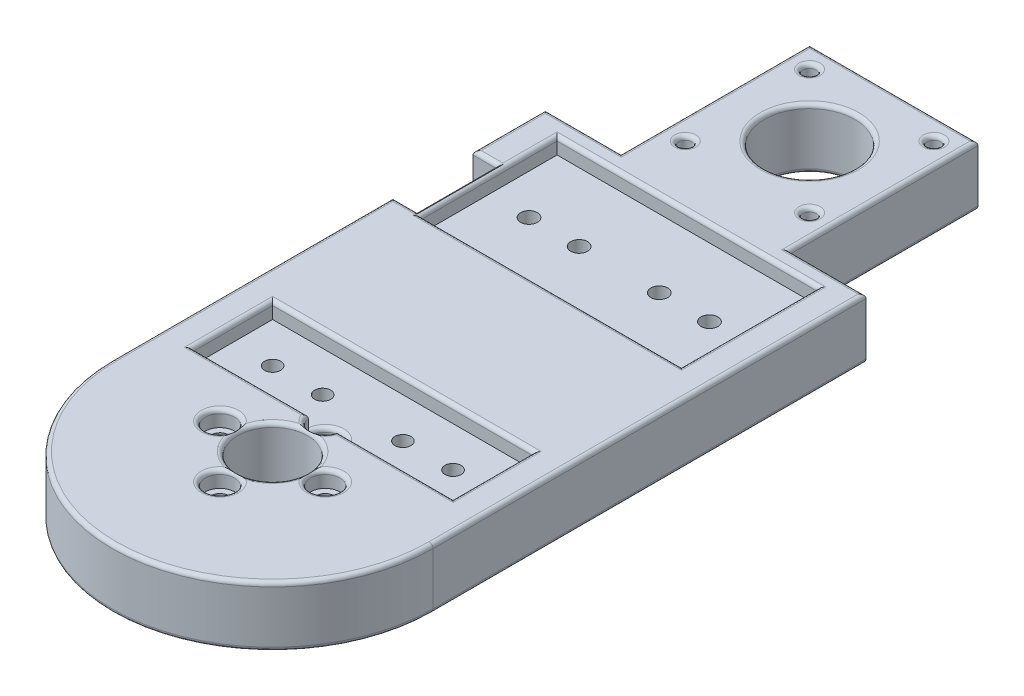
from build123d import *

# Parameters (mm, degrees)
SKIZZE1_W                        = 42
SKIZZE1_H                        = 47
SKIZZE1_R                        = 1.65
SKIZZE1_R_2                      = 11.3
SKIZZE1_R_3                      = 40
SKIZZE1_R_4                      = 17.5
SKIZZE1_R_5                      = 2.1
SKIZZE1_R_6                      = 8.75
AUFSATZ_LINEAR_AUSTRAGEN1_DEPTH  = 15
SCHNITT_LINEAR_AUSTRAGEN3_DEPTH  = 4
SKIZZE6_R                        = 2
SCHNITT_LINEAR_AUSTRAGEN4_DEPTH  = 11
SKIZZE14_W                       = 6
SKIZZE14_H                       = 20
SCHNITT_LINEAR_AUSTRAGEN11_DEPTH = 15
SKIZZE15_R                       = 2.25
SCHNITT_LINEAR_AUSTRAGEN12_DEPTH = 6
SKIZZE19_W                       = 65
SKIZZE19_H                       = 34
SCHNITT_LINEAR_AUSTRAGEN15_DEPTH = 4
SKIZZE21_R                       = 2.1
SCHNITT_LINEAR_AUSTRAGEN16_DEPTH = 11
SKIZZE22_R                       = 3.65
SCHNITT_LINEAR_AUSTRAGEN17_DEPTH = 4
SKIZZE23_R                       = 3.2
SKIZZE23_R_2                     = 11.3
SCHNITT_LINEAR_AUSTRAGEN18_DEPTH = 3
SKETCH5_R                        = 3.65
CUT_EXTRUDE3_DEPTH               = 4
SKIZZE24_R                       = 3.65
SCHNITT_LINEAR_AUSTRAGEN19_DEPTH = 4
VERRUNDUNG1_R                    = 1


with BuildPart() as part:
    # Skizze1 → Aufsatz-Linear austragen1 (new body)
    # profile 1 of 4: a face of its own
    with BuildSketch(Plane(origin=(0, 0, 0), x_dir=(1, 0, 0), z_dir=(0, 1, 0))):
        with Locations((-0.084777034, 131.5)):
            Rectangle(SKIZZE1_W, SKIZZE1_H)
        with Locations(Location((-15.584777034, 118.5, 0), (0, 0, 270))):
            Circle(SKIZZE1_R, mode=Mode.SUBTRACT)
        with Locations(Location((-15.584777034, 149.5, 0), (0, 0, 270))):
            Circle(SKIZZE1_R, mode=Mode.SUBTRACT)
        with Locations(Location((-0.084777034, 134, 0), (0, 0, 270))):
            Circle(SKIZZE1_R_2, mode=Mode.SUBTRACT)
        with Locations(Location((15.415222966, 118.5, 0), (0, 0, 270))):
            Circle(SKIZZE1_R, mode=Mode.SUBTRACT)
        with Locations(Location((15.415222966, 149.5, 0), (0, 0, 270))):
            Circle(SKIZZE1_R, mode=Mode.SUBTRACT)
    # profile 2 of 4: a face of its own
    with BuildSketch(Plane(origin=(0, 0, 0), x_dir=(1, 0, 0), z_dir=(0, 1, 0))):
        with BuildLine():
            Line((-40, 78), (-40, 0))
            ThreePointArc((-40, 0), (0, 40), (40, 0))
            Line((40, 0), (40, 108))
            Line((40, 108), (20.915222966, 108))
            Line((20.915222966, 108), (-21.084777034, 108))
            Line((-21.084777034, 108), (-40, 108))
            Line((-40, 108), (-40, 78))
        make_face()
    # profile 3 of 4: a face of its own
    with BuildSketch(Plane(origin=(0, 0, 0), x_dir=(1, 0, 0), z_dir=(0, 1, 0))):
        Circle(SKIZZE1_R_3)
        Circle(SKIZZE1_R_4, mode=Mode.SUBTRACT)
    # profile 4 of 4: a face of its own
    with BuildSketch(Plane(origin=(0, 0, 0), x_dir=(1, 0, 0), z_dir=(0, 1, 0))):
        Circle(SKIZZE1_R_4)
        with Locations(Location((-13.125, 0, 0), (0, 0, 270))):
            Circle(SKIZZE1_R_5, mode=Mode.SUBTRACT)
        with Locations(Location((0, -13.125, 0), (0, 0, 270))):
            Circle(SKIZZE1_R_5, mode=Mode.SUBTRACT)
        with Locations(Location((13.125, 0, 0), (0, 0, 270))):
            Circle(SKIZZE1_R_5, mode=Mode.SUBTRACT)
        with Locations(Location((0, 13.125, 0), (0, 0, 270))):
            Circle(SKIZZE1_R_5, mode=Mode.SUBTRACT)
        with Locations(Location((0, 0, 0), (0, 0, 270))):
            Circle(SKIZZE1_R_6, mode=Mode.SUBTRACT)
    extrude(amount=AUFSATZ_LINEAR_AUSTRAGEN1_DEPTH)

    # Skizze5 → Schnitt-Linear austragen3 (cut)
    with BuildSketch(Plane(origin=(0, 15, 0), x_dir=(1, 0, 0), z_dir=(0, 1, 0))):
        Polygon((32.5, 32.5), (-25, 32.5), (-32.5, 32.5), (-32.5, 12.5), (32.5, 12.5), align=None)
    extrude(amount=-SCHNITT_LINEAR_AUSTRAGEN3_DEPTH, mode=Mode.SUBTRACT)

    # Skizze6 → Schnitt-Linear austragen4 (cut)
    with BuildSketch(Plane(origin=(0, 11, 0), x_dir=(1, 0, 0), z_dir=(0, 1, 0))):
        with Locations(Location((10, 22.5, 0), (0, 0, 270))):
            Circle(SKIZZE6_R)
        with Locations(Location((-10, 22.5, 0), (0, 0, 90))):
            Circle(SKIZZE6_R)
        with Locations(Location((22.5, 22.5, 0), (0, 0, 270))):
            Circle(SKIZZE6_R)
        with Locations(Location((-22.5, 22.5, 0), (0, 0, 90))):
            Circle(SKIZZE6_R)
    extrude(amount=-SCHNITT_LINEAR_AUSTRAGEN4_DEPTH, mode=Mode.SUBTRACT)

    # Skizze14 → Schnitt-Linear austragen11 (cut)
    with BuildSketch(Plane(origin=(0, 15, 0), x_dir=(1, 0, 0), z_dir=(0, 1, 0))):
        with Locations((-37, 80)):
            Rectangle(SKIZZE14_W, SKIZZE14_H)
    extrude(amount=-SCHNITT_LINEAR_AUSTRAGEN11_DEPTH, mode=Mode.SUBTRACT)

    # Skizze15 → Schnitt-Linear austragen12 (cut)
    with BuildSketch(Plane.ZY.offset(34)):
        with Locations((-84.5, 7.5)):
            Circle(SKIZZE15_R)
        with Locations((-75, 7.5)):
            Circle(SKIZZE15_R)
    extrude(amount=-SCHNITT_LINEAR_AUSTRAGEN12_DEPTH, mode=Mode.SUBTRACT)

    # Skizze19 → Schnitt-Linear austragen15 (cut)
    with BuildSketch(Plane(origin=(0, 15, 0), x_dir=(1, 0, 0), z_dir=(0, 1, 0))):
        with Locations((-0.054725473, 86.5)):
            Rectangle(SKIZZE19_W, SKIZZE19_H)
    extrude(amount=-SCHNITT_LINEAR_AUSTRAGEN15_DEPTH, mode=Mode.SUBTRACT)

    # Skizze21 → Schnitt-Linear austragen16 (cut)
    with BuildSketch(Plane(origin=(0, 11, 0), x_dir=(1, 0, 0), z_dir=(0, 1, 0))):
        with Locations(Location((22.445274527, 86.5, 0), (0, 0, 270))):
            Circle(SKIZZE21_R)
        with Locations(Location((9.945274527, 86.5, 0), (0, 0, 270))):
            Circle(SKIZZE21_R)
        with Locations(Location((-22.55483254, 86.5, 0), (0, 0, 90))):
            Circle(SKIZZE21_R)
        with Locations(Location((-10.05483254, 86.5, 0), (0, 0, 90))):
            Circle(SKIZZE21_R)
    extrude(amount=-SCHNITT_LINEAR_AUSTRAGEN16_DEPTH, mode=Mode.SUBTRACT)

    # Skizze22 → Schnitt-Linear austragen17 (cut)
    with BuildSketch(Plane.XZ):
        with Locations(Location((-22.55483254, -86.5, 0), (0, 0, 270))):
            Circle(SKIZZE22_R)
        with Locations(Location((-10.05483254, -86.5, 0), (0, 0, 270))):
            Circle(SKIZZE22_R)
        with Locations(Location((10.05483254, -86.5, 0), (0, 0, 90))):
            Circle(SKIZZE22_R)
        with Locations(Location((22.55483254, -86.5, 0), (0, 0, 90))):
            Circle(SKIZZE22_R)
        with Locations(Location((-22.5, -22.5, 0), (0, 0, 270))):
            Circle(SKIZZE22_R)
        with Locations(Location((-10, -22.5, 0), (0, 0, 270))):
            Circle(SKIZZE22_R)
        with Locations(Location((10, -22.5, 0), (0, 0, 90))):
            Circle(SKIZZE22_R)
        with Locations(Location((22.5, -22.5, 0), (0, 0, 90))):
            Circle(SKIZZE22_R)
    extrude(amount=-SCHNITT_LINEAR_AUSTRAGEN17_DEPTH, mode=Mode.SUBTRACT)

    # Skizze23 → Schnitt-Linear austragen18 (cut)
    with BuildSketch(Plane.XZ):
        with Locations(Location((-15.584777034, -118.5, 0), (0, 0, 270))):
            Circle(SKIZZE23_R)
        with Locations(Location((-0.084777034, -134, 0), (0, 0, 90))):
            Circle(SKIZZE23_R_2)
        with Locations(Location((15.415222966, -118.5, 0), (0, 0, 270))):
            Circle(SKIZZE23_R)
        with Locations(Location((15.415222966, -149.5, 0), (0, 0, 270))):
            Circle(SKIZZE23_R)
        with Locations(Location((-15.584777034, -149.5, 0), (0, 0, 270))):
            Circle(SKIZZE23_R)
    extrude(amount=-SCHNITT_LINEAR_AUSTRAGEN18_DEPTH, mode=Mode.SUBTRACT)

    # Sketch5 → Cut-Extrude3 (cut)
    with BuildSketch(Plane(origin=(0, 15, 0), x_dir=(1, 0, 0), z_dir=(0, 1, 0))):
        with Locations(Location((-13.125, 0, 0), (0, 0, 270))):
            Circle(SKETCH5_R)
        with Locations((0, 13.125)):
            Circle(SKETCH5_R)
        with Locations(Location((13.125, 0, 0), (0, 0, 270))):
            Circle(SKETCH5_R)
        with Locations(Location((0, -13.125, 0), (0, 0, 270))):
            Circle(SKETCH5_R)
    extrude(amount=-CUT_EXTRUDE3_DEPTH, mode=Mode.SUBTRACT)

    # Skizze24 → Schnitt-Linear austragen19 (cut)
    with BuildSketch(Plane(origin=(0, 11, 0), x_dir=(1, 0, 0), z_dir=(0, 1, 0))):
        with Locations(Location((0, 13.125, 0), (0, 0, 270))):
            Circle(SKIZZE24_R)
    extrude(amount=-SCHNITT_LINEAR_AUSTRAGEN19_DEPTH, mode=Mode.SUBTRACT)

    # Verrundung1
    # the kernel refuses this fillet: 1 mm, written as the material it takes off along each edge
    with BuildSketch(Plane(origin=(0, 15, 0), x_dir=(0, 0, 1), z_dir=(-1, 0, 0))) as verrundung1_piece_1:
        with BuildLine():
            CenterArc((8.75 + VERRUNDUNG1_R, -VERRUNDUNG1_R), VERRUNDUNG1_R, 90, 90)
            Line((8.75, -VERRUNDUNG1_R), (8.75, 0))
            Line((8.75, 0), (8.75 + VERRUNDUNG1_R, 0))
        make_face()
    revolve(axis=Axis((0, 15, 0), (0, 1, 0)), mode=Mode.SUBTRACT)
    with BuildSketch(Plane(origin=(-40, 0, -110.5), x_dir=(1, 0, 0), z_dir=(0, 0, 1)), Plane(origin=(-40, 15, -87.5), x_dir=(1, 0, 0), z_dir=(0, 0, -1))) as verrundung1_piece_2:
        with BuildLine():
            CenterArc((VERRUNDUNG1_R, VERRUNDUNG1_R), VERRUNDUNG1_R, 180, 90)
            Line((0, VERRUNDUNG1_R), (0, 0))
            Line((0, 0), (VERRUNDUNG1_R, 0))
        make_face()
    extrude(amount=23, mode=Mode.SUBTRACT)
    with BuildSketch(Plane(origin=(-34, 0, -70), x_dir=(0, 0, 1), z_dir=(-1, 0, 0)), Plane(origin=(-42.5, 0, -90), x_dir=(0, 0, -1), z_dir=(1, 0, 0))) as verrundung1_piece_3:
        with BuildLine():
            CenterArc((VERRUNDUNG1_R, VERRUNDUNG1_R), VERRUNDUNG1_R, 180, 90)
            Line((0, VERRUNDUNG1_R), (0, 0))
            Line((0, 0), (VERRUNDUNG1_R, 0))
        make_face()
    extrude(amount=8.5, mode=Mode.SUBTRACT)
    with BuildSketch(Plane(origin=(-42.5, 15, -90), x_dir=(0, 0, -1), z_dir=(1, 0, 0)), Plane(origin=(-34, 15, -70), x_dir=(0, 0, 1), z_dir=(-1, 0, 0))) as verrundung1_piece_4:
        with BuildLine():
            CenterArc((VERRUNDUNG1_R, -VERRUNDUNG1_R), VERRUNDUNG1_R, 90, 90)
            Line((0, -VERRUNDUNG1_R), (0, 0))
            Line((0, 0), (VERRUNDUNG1_R, 0))
        make_face()
    extrude(amount=8.5, mode=Mode.SUBTRACT)
    with BuildSketch(Plane(origin=(-34, 15, -90), x_dir=(1, 0, 0), z_dir=(0, 0, 1))) as verrundung1_piece_5:
        with BuildLine():
            CenterArc((VERRUNDUNG1_R, -VERRUNDUNG1_R), VERRUNDUNG1_R, 90, 90)
            Line((0, -VERRUNDUNG1_R), (0, 0))
            Line((0, 0), (VERRUNDUNG1_R, 0))
        make_face()
    extrude(amount=20, mode=Mode.SUBTRACT)
    with BuildSketch(Plane(origin=(-34, 0, -90), x_dir=(1, 0, 0), z_dir=(0, 0, 1)), Plane(origin=(-32.5, 15, -32.5), x_dir=(-1, 0, 0), z_dir=(0, 0, 1)), Plane(origin=(32.5, 15, -12.5), x_dir=(1, 0, 0), z_dir=(0, 0, -1))) as verrundung1_piece_6:
        with BuildLine():
            CenterArc((VERRUNDUNG1_R, VERRUNDUNG1_R), VERRUNDUNG1_R, 180, 90)
            Line((0, VERRUNDUNG1_R), (0, 0))
            Line((0, 0), (VERRUNDUNG1_R, 0))
        make_face()
    extrude(amount=20, mode=Mode.SUBTRACT)
    with BuildSketch(Plane(origin=(32.445274527, 15, -69.5), x_dir=(1, 0, 0), z_dir=(0, 0, -1)), Plane(origin=(-32.554725473, 15, -103.5), x_dir=(-1, 0, 0), z_dir=(0, 0, 1))) as verrundung1_piece_7:
        with BuildLine():
            CenterArc((VERRUNDUNG1_R, VERRUNDUNG1_R), VERRUNDUNG1_R, 180, 90)
            Line((0, VERRUNDUNG1_R), (0, 0))
            Line((0, 0), (VERRUNDUNG1_R, 0))
        make_face()
    extrude(amount=34, mode=Mode.SUBTRACT)
    with BuildSketch(Plane(origin=(32.445274527, 15, -103.5), x_dir=(0, 0, -1), z_dir=(-1, 0, 0)), Plane(origin=(-32.554725473, 15, -69.5), x_dir=(0, 0, 1), z_dir=(1, 0, 0))) as verrundung1_piece_8:
        with BuildLine():
            CenterArc((VERRUNDUNG1_R, VERRUNDUNG1_R), VERRUNDUNG1_R, 180, 90)
            Line((0, VERRUNDUNG1_R), (0, 0))
            Line((0, 0), (VERRUNDUNG1_R, 0))
        make_face()
    extrude(amount=65, mode=Mode.SUBTRACT)
    with BuildSketch(Plane(origin=(-15.584777034, 15, -118.5), x_dir=(0, 0, 1), z_dir=(-1, 0, 0))) as verrundung1_piece_9:
        with BuildLine():
            CenterArc((1.65 + VERRUNDUNG1_R, -VERRUNDUNG1_R), VERRUNDUNG1_R, 90, 90)
            Line((1.65, -VERRUNDUNG1_R), (1.65, 0))
            Line((1.65, 0), (1.65 + VERRUNDUNG1_R, 0))
        make_face()
    revolve(axis=Axis((-15.584777034, 15, -118.5), (0, 1, 0)), mode=Mode.SUBTRACT)
    with BuildSketch(Plane(origin=(-22.5, 0, -22.5), x_dir=(0, 0, -1), z_dir=(-1, 0, 0))) as verrundung1_piece_10:
        with BuildLine():
            CenterArc((3.65 + VERRUNDUNG1_R, -VERRUNDUNG1_R), VERRUNDUNG1_R, 90, 90)
            Line((3.65, -VERRUNDUNG1_R), (3.65, 0))
            Line((3.65, 0), (3.65 + VERRUNDUNG1_R, 0))
        make_face()
    revolve(axis=Axis((-22.5, 0, -22.5), (0, -1, 0)), mode=Mode.SUBTRACT)
    with BuildSketch(Plane(origin=(22.55483254, 0, -86.5), x_dir=(0, 0, 1), z_dir=(1, 0, 0))) as verrundung1_piece_11:
        with BuildLine():
            CenterArc((3.65 + VERRUNDUNG1_R, -VERRUNDUNG1_R), VERRUNDUNG1_R, 90, 90)
            Line((3.65, -VERRUNDUNG1_R), (3.65, 0))
            Line((3.65, 0), (3.65 + VERRUNDUNG1_R, 0))
        make_face()
    revolve(axis=Axis((22.55483254, 0, -86.5), (0, -1, 0)), mode=Mode.SUBTRACT)
    with BuildSketch(Plane(origin=(10.05483254, 0, -86.5), x_dir=(0, 0, 1), z_dir=(1, 0, 0))) as verrundung1_piece_12:
        with BuildLine():
            CenterArc((3.65 + VERRUNDUNG1_R, -VERRUNDUNG1_R), VERRUNDUNG1_R, 90, 90)
            Line((3.65, -VERRUNDUNG1_R), (3.65, 0))
            Line((3.65, 0), (3.65 + VERRUNDUNG1_R, 0))
        make_face()
    revolve(axis=Axis((10.05483254, 0, -86.5), (0, -1, 0)), mode=Mode.SUBTRACT)
    with BuildSketch(Plane(origin=(15.415222966, 15, -118.5), x_dir=(0, 0, 1), z_dir=(-1, 0, 0))) as verrundung1_piece_13:
        with BuildLine():
            CenterArc((1.65 + VERRUNDUNG1_R, -VERRUNDUNG1_R), VERRUNDUNG1_R, 90, 90)
            Line((1.65, -VERRUNDUNG1_R), (1.65, 0))
            Line((1.65, 0), (1.65 + VERRUNDUNG1_R, 0))
        make_face()
    revolve(axis=Axis((15.415222966, 15, -118.5), (0, 1, 0)), mode=Mode.SUBTRACT)
    with BuildSketch(Plane(origin=(-10.05483254, 0, -86.5), x_dir=(0, 0, -1), z_dir=(-1, 0, 0))) as verrundung1_piece_14:
        with BuildLine():
            CenterArc((3.65 + VERRUNDUNG1_R, -VERRUNDUNG1_R), VERRUNDUNG1_R, 90, 90)
            Line((3.65, -VERRUNDUNG1_R), (3.65, 0))
            Line((3.65, 0), (3.65 + VERRUNDUNG1_R, 0))
        make_face()
    revolve(axis=Axis((-10.05483254, 0, -86.5), (0, -1, 0)), mode=Mode.SUBTRACT)
    with BuildSketch(Plane(origin=(-10, 0, -22.5), x_dir=(0, 0, -1), z_dir=(-1, 0, 0))) as verrundung1_piece_15:
        with BuildLine():
            CenterArc((3.65 + VERRUNDUNG1_R, -VERRUNDUNG1_R), VERRUNDUNG1_R, 90, 90)
            Line((3.65, -VERRUNDUNG1_R), (3.65, 0))
            Line((3.65, 0), (3.65 + VERRUNDUNG1_R, 0))
        make_face()
    revolve(axis=Axis((-10, 0, -22.5), (0, -1, 0)), mode=Mode.SUBTRACT)
    with BuildSketch(Plane(origin=(10, 0, -22.5), x_dir=(0, 0, 1), z_dir=(1, 0, 0))) as verrundung1_piece_16:
        with BuildLine():
            CenterArc((3.65 + VERRUNDUNG1_R, -VERRUNDUNG1_R), VERRUNDUNG1_R, 90, 90)
            Line((3.65, -VERRUNDUNG1_R), (3.65, 0))
            Line((3.65, 0), (3.65 + VERRUNDUNG1_R, 0))
        make_face()
    revolve(axis=Axis((10, 0, -22.5), (0, -1, 0)), mode=Mode.SUBTRACT)
    with BuildSketch(Plane(origin=(22.5, 0, -22.5), x_dir=(0, 0, 1), z_dir=(1, 0, 0))) as verrundung1_piece_17:
        with BuildLine():
            CenterArc((3.65 + VERRUNDUNG1_R, -VERRUNDUNG1_R), VERRUNDUNG1_R, 90, 90)
            Line((3.65, -VERRUNDUNG1_R), (3.65, 0))
            Line((3.65, 0), (3.65 + VERRUNDUNG1_R, 0))
        make_face()
    revolve(axis=Axis((22.5, 0, -22.5), (0, -1, 0)), mode=Mode.SUBTRACT)
    with BuildSketch(Plane(origin=(-22.55483254, 0, -86.5), x_dir=(0, 0, -1), z_dir=(-1, 0, 0))) as verrundung1_piece_18:
        with BuildLine():
            CenterArc((3.65 + VERRUNDUNG1_R, -VERRUNDUNG1_R), VERRUNDUNG1_R, 90, 90)
            Line((3.65, -VERRUNDUNG1_R), (3.65, 0))
            Line((3.65, 0), (3.65 + VERRUNDUNG1_R, 0))
        make_face()
    revolve(axis=Axis((-22.55483254, 0, -86.5), (0, -1, 0)), mode=Mode.SUBTRACT)
    with BuildSketch(Plane(origin=(0, 0, 0), x_dir=(0, 0, 1), z_dir=(-1, 0, 0))) as verrundung1_piece_19:
        with BuildLine():
            CenterArc((8.75 + VERRUNDUNG1_R, VERRUNDUNG1_R), VERRUNDUNG1_R, 180, 90)
            Line((8.75, VERRUNDUNG1_R), (8.75, 0))
            Line((8.75, 0), (8.75 + VERRUNDUNG1_R, 0))
        make_face()
    revolve(axis=Axis((0, 0, 0), (0, 1, 0)), mode=Mode.SUBTRACT)
    with BuildSketch(Plane(origin=(0, 0, -13.125), x_dir=(0, 0, 1), z_dir=(-1, 0, 0))) as verrundung1_piece_20:
        with BuildLine():
            CenterArc((2.1 + VERRUNDUNG1_R, VERRUNDUNG1_R), VERRUNDUNG1_R, 180, 90)
            Line((2.1, VERRUNDUNG1_R), (2.1, 0))
            Line((2.1, 0), (2.1 + VERRUNDUNG1_R, 0))
        make_face()
    revolve(axis=Axis((0, 0, -13.125), (0, 1, 0)), mode=Mode.SUBTRACT)
    with BuildSketch(Plane(origin=(13.125, 0, 0), x_dir=(0, 0, 1), z_dir=(-1, 0, 0))) as verrundung1_piece_21:
        with BuildLine():
            CenterArc((2.1 + VERRUNDUNG1_R, VERRUNDUNG1_R), VERRUNDUNG1_R, 180, 90)
            Line((2.1, VERRUNDUNG1_R), (2.1, 0))
            Line((2.1, 0), (2.1 + VERRUNDUNG1_R, 0))
        make_face()
    revolve(axis=Axis((13.125, 0, 0), (0, 1, 0)), mode=Mode.SUBTRACT)
    with BuildSketch(Plane(origin=(0, 0, 13.125), x_dir=(0, 0, 1), z_dir=(-1, 0, 0))) as verrundung1_piece_22:
        with BuildLine():
            CenterArc((2.1 + VERRUNDUNG1_R, VERRUNDUNG1_R), VERRUNDUNG1_R, 180, 90)
            Line((2.1, VERRUNDUNG1_R), (2.1, 0))
            Line((2.1, 0), (2.1 + VERRUNDUNG1_R, 0))
        make_face()
    revolve(axis=Axis((0, 0, 13.125), (0, 1, 0)), mode=Mode.SUBTRACT)
    with BuildSketch(Plane(origin=(-13.125, 0, 0), x_dir=(0, 0, 1), z_dir=(-1, 0, 0))) as verrundung1_piece_23:
        with BuildLine():
            CenterArc((2.1 + VERRUNDUNG1_R, VERRUNDUNG1_R), VERRUNDUNG1_R, 180, 90)
            Line((2.1, VERRUNDUNG1_R), (2.1, 0))
            Line((2.1, 0), (2.1 + VERRUNDUNG1_R, 0))
        make_face()
    revolve(axis=Axis((-13.125, 0, 0), (0, 1, 0)), mode=Mode.SUBTRACT)
    with BuildSketch(Plane(origin=(23.415222966, 0, -155), x_dir=(0, 0, 1), z_dir=(-1, 0, 0))) as verrundung1_piece_24:
        with BuildLine():
            CenterArc((VERRUNDUNG1_R, VERRUNDUNG1_R), VERRUNDUNG1_R, 180, 90)
            Line((0, VERRUNDUNG1_R), (0, 0))
            Line((0, 0), (VERRUNDUNG1_R, 0))
        make_face()
    extrude(amount=47, mode=Mode.SUBTRACT)
    with BuildSketch(Plane(origin=(-15.584777034, 0, -149.5), x_dir=(0, 0, -1), z_dir=(-1, 0, 0))) as verrundung1_piece_25:
        with BuildLine():
            CenterArc((3.2 + VERRUNDUNG1_R, -VERRUNDUNG1_R), VERRUNDUNG1_R, 90, 90)
            Line((3.2, -VERRUNDUNG1_R), (3.2, 0))
            Line((3.2, 0), (3.2 + VERRUNDUNG1_R, 0))
        make_face()
    revolve(axis=Axis((-15.584777034, 0, -149.5), (0, -1, 0)), mode=Mode.SUBTRACT)
    with BuildSketch(Plane(origin=(15.415222966, 0, -149.5), x_dir=(0, 0, -1), z_dir=(-1, 0, 0))) as verrundung1_piece_26:
        with BuildLine():
            CenterArc((3.2 + VERRUNDUNG1_R, -VERRUNDUNG1_R), VERRUNDUNG1_R, 90, 90)
            Line((3.2, -VERRUNDUNG1_R), (3.2, 0))
            Line((3.2, 0), (3.2 + VERRUNDUNG1_R, 0))
        make_face()
    revolve(axis=Axis((15.415222966, 0, -149.5), (0, -1, 0)), mode=Mode.SUBTRACT)
    with BuildSketch(Plane(origin=(20.915222966, 0, -108), x_dir=(-1, 0, 0), z_dir=(0, 0, -1)), Plane(origin=(-21.084777034, 0, -157.5), x_dir=(1, 0, 0), z_dir=(0, 0, 1))) as verrundung1_piece_27:
        with BuildLine():
            CenterArc((VERRUNDUNG1_R, VERRUNDUNG1_R), VERRUNDUNG1_R, 180, 90)
            Line((0, VERRUNDUNG1_R), (0, 0))
            Line((0, 0), (VERRUNDUNG1_R, 0))
        make_face()
    extrude(amount=49.5, mode=Mode.SUBTRACT)
    with BuildSketch(Plane(origin=(15.415222966, 0, -118.5), x_dir=(0, 0, -1), z_dir=(-1, 0, 0))) as verrundung1_piece_28:
        with BuildLine():
            CenterArc((3.2 + VERRUNDUNG1_R, -VERRUNDUNG1_R), VERRUNDUNG1_R, 90, 90)
            Line((3.2, -VERRUNDUNG1_R), (3.2, 0))
            Line((3.2, 0), (3.2 + VERRUNDUNG1_R, 0))
        make_face()
    revolve(axis=Axis((15.415222966, 0, -118.5), (0, -1, 0)), mode=Mode.SUBTRACT)
    with BuildSketch(Plane(origin=(15.415222966, 15, -149.5), x_dir=(0, 0, 1), z_dir=(-1, 0, 0))) as verrundung1_piece_29:
        with BuildLine():
            CenterArc((1.65 + VERRUNDUNG1_R, -VERRUNDUNG1_R), VERRUNDUNG1_R, 90, 90)
            Line((1.65, -VERRUNDUNG1_R), (1.65, 0))
            Line((1.65, 0), (1.65 + VERRUNDUNG1_R, 0))
        make_face()
    revolve(axis=Axis((15.415222966, 15, -149.5), (0, 1, 0)), mode=Mode.SUBTRACT)
    with BuildSketch(Plane(origin=(42.5, 0, -108), x_dir=(0, 1, 0), z_dir=(-1, 0, 0)), Plane(origin=(20.915222966, 15, -108), x_dir=(0, -1, 0), z_dir=(1, 0, 0))) as verrundung1_piece_30:
        with BuildLine():
            CenterArc((VERRUNDUNG1_R, -VERRUNDUNG1_R), VERRUNDUNG1_R, 90, 90)
            Line((0, -VERRUNDUNG1_R), (0, 0))
            Line((0, 0), (VERRUNDUNG1_R, 0))
        make_face()
    extrude(amount=21.584777034, mode=Mode.SUBTRACT)
    with BuildSketch(Plane(origin=(-15.584777034, 0, -118.5), x_dir=(0, 0, -1), z_dir=(-1, 0, 0))) as verrundung1_piece_31:
        with BuildLine():
            CenterArc((3.2 + VERRUNDUNG1_R, -VERRUNDUNG1_R), VERRUNDUNG1_R, 90, 90)
            Line((3.2, -VERRUNDUNG1_R), (3.2, 0))
            Line((3.2, 0), (3.2 + VERRUNDUNG1_R, 0))
        make_face()
    revolve(axis=Axis((-15.584777034, 0, -118.5), (0, -1, 0)), mode=Mode.SUBTRACT)
    with BuildSketch(Plane(origin=(40, 0, 0), x_dir=(0, 1, 0), z_dir=(0, 0, -1))) as verrundung1_piece_32:
        with BuildLine():
            CenterArc((VERRUNDUNG1_R, -VERRUNDUNG1_R), VERRUNDUNG1_R, 90, 90)
            Line((0, -VERRUNDUNG1_R), (0, 0))
            Line((0, 0), (VERRUNDUNG1_R, 0))
        make_face()
    extrude(amount=110.5, mode=Mode.SUBTRACT)
    with BuildSketch(Plane(origin=(0, 0, 0), x_dir=(-1, 0, 0), z_dir=(0, 0, -1))) as verrundung1_piece_33:
        with BuildLine():
            CenterArc((40 - VERRUNDUNG1_R, VERRUNDUNG1_R), VERRUNDUNG1_R, 270, 90)
            Line((40 - VERRUNDUNG1_R, 0), (40, 0))
            Line((40, 0), (40, VERRUNDUNG1_R))
        make_face()
    revolve(axis=Axis((0, 0, 0), (0, 1, 0)), revolution_arc=180, mode=Mode.SUBTRACT)
    with BuildSketch(Plane(origin=(-40, 0, -72.5), x_dir=(1, 0, 0), z_dir=(0, 0, 1)), Plane(origin=(-40, 15, 0), x_dir=(1, 0, 0), z_dir=(0, 0, -1))) as verrundung1_piece_34:
        with BuildLine():
            CenterArc((VERRUNDUNG1_R, VERRUNDUNG1_R), VERRUNDUNG1_R, 180, 90)
            Line((0, VERRUNDUNG1_R), (0, 0))
            Line((0, 0), (VERRUNDUNG1_R, 0))
        make_face()
    extrude(amount=72.5, mode=Mode.SUBTRACT)
    with BuildSketch(Plane(origin=(1.096091628, 15, -12.5), x_dir=(0, 0, 1), z_dir=(1, 0, 0)), Plane(origin=(-32.5, 15, -12.5), x_dir=(0, 0, 1), z_dir=(1, 0, 0))) as verrundung1_piece_35:
        with BuildLine():
            CenterArc((VERRUNDUNG1_R, VERRUNDUNG1_R), VERRUNDUNG1_R, 180, 90)
            Line((0, VERRUNDUNG1_R), (0, 0))
            Line((0, 0), (VERRUNDUNG1_R, 0))
        make_face()
    extrude(amount=31.403908372, mode=Mode.SUBTRACT)
    with BuildSketch(Plane(origin=(-21.084777034, 0, -108), x_dir=(0, 0, 1), z_dir=(-1, 0, 0)), Plane(origin=(-42.5, 15, -108), x_dir=(0, 0, 1), z_dir=(1, 0, 0))) as verrundung1_piece_36:
        with BuildLine():
            CenterArc((VERRUNDUNG1_R, VERRUNDUNG1_R), VERRUNDUNG1_R, 180, 90)
            Line((0, VERRUNDUNG1_R), (0, 0))
            Line((0, 0), (VERRUNDUNG1_R, 0))
        make_face()
    extrude(amount=21.415222966, mode=Mode.SUBTRACT)
    with BuildSketch(Plane(origin=(-13.125, 15, 0), x_dir=(0, 0, 1), z_dir=(-1, 0, 0))) as verrundung1_piece_37:
        with BuildLine():
            CenterArc((3.65 + VERRUNDUNG1_R, -VERRUNDUNG1_R), VERRUNDUNG1_R, 90, 90)
            Line((3.65, -VERRUNDUNG1_R), (3.65, 0))
            Line((3.65, 0), (3.65 + VERRUNDUNG1_R, 0))
        make_face()
    revolve(axis=Axis((-13.125, 15, 0), (0, 1, 0)), mode=Mode.SUBTRACT)
    with BuildSketch(Plane(origin=(0, 15, -13.125), x_dir=(-0.8709205906379706, 0, -0.4914237731355783), z_dir=(0.4914237731355783, 0, -0.8709205906379706))) as verrundung1_piece_38:
        with BuildLine():
            CenterArc((3.65 + VERRUNDUNG1_R, -VERRUNDUNG1_R), VERRUNDUNG1_R, 90, 90)
            Line((3.65, -VERRUNDUNG1_R), (3.65, 0))
            Line((3.65, 0), (3.65 + VERRUNDUNG1_R, 0))
        make_face()
    revolve(axis=Axis((0, 15, -13.125), (0, 1, 0)), revolution_arc=238.868410159, mode=Mode.SUBTRACT)
    with BuildSketch(Plane(origin=(-0.084777034, 0, -134), x_dir=(0, 0, 1), z_dir=(-1, 0, 0))) as verrundung1_piece_39:
        with BuildLine():
            CenterArc((11.3 + VERRUNDUNG1_R, VERRUNDUNG1_R), VERRUNDUNG1_R, 180, 90)
            Line((11.3, VERRUNDUNG1_R), (11.3, 0))
            Line((11.3, 0), (11.3 + VERRUNDUNG1_R, 0))
        make_face()
    revolve(axis=Axis((-0.084777034, 0, -134), (0, 1, 0)), mode=Mode.SUBTRACT)
    with BuildSketch(Plane(origin=(13.125, 15, 0), x_dir=(0, 0, 1), z_dir=(-1, 0, 0))) as verrundung1_piece_40:
        with BuildLine():
            CenterArc((3.65 + VERRUNDUNG1_R, -VERRUNDUNG1_R), VERRUNDUNG1_R, 90, 90)
            Line((3.65, -VERRUNDUNG1_R), (3.65, 0))
            Line((3.65, 0), (3.65 + VERRUNDUNG1_R, 0))
        make_face()
    revolve(axis=Axis((13.125, 15, 0), (0, 1, 0)), mode=Mode.SUBTRACT)
    with BuildSketch(Plane(origin=(0, 15, 13.125), x_dir=(0, 0, 1), z_dir=(-1, 0, 0))) as verrundung1_piece_41:
        with BuildLine():
            CenterArc((3.65 + VERRUNDUNG1_R, -VERRUNDUNG1_R), VERRUNDUNG1_R, 90, 90)
            Line((3.65, -VERRUNDUNG1_R), (3.65, 0))
            Line((3.65, 0), (3.65 + VERRUNDUNG1_R, 0))
        make_face()
    revolve(axis=Axis((0, 15, 13.125), (0, 1, 0)), mode=Mode.SUBTRACT)
    with BuildSketch(Plane(origin=(-15.584777034, 15, -149.5), x_dir=(0, 0, 1), z_dir=(-1, 0, 0))) as verrundung1_piece_42:
        with BuildLine():
            CenterArc((1.65 + VERRUNDUNG1_R, -VERRUNDUNG1_R), VERRUNDUNG1_R, 90, 90)
            Line((1.65, -VERRUNDUNG1_R), (1.65, 0))
            Line((1.65, 0), (1.65 + VERRUNDUNG1_R, 0))
        make_face()
    revolve(axis=Axis((-15.584777034, 15, -149.5), (0, 1, 0)), mode=Mode.SUBTRACT)
    with BuildSketch(Plane(origin=(0, 11, -13.125), x_dir=(0.6536727855523831, 0, 0.7567773050430279), z_dir=(-0.7567773050430279, 0, 0.6536727855523831))) as verrundung1_piece_43_section:
        with BuildLine():
            CenterArc((3.65 + VERRUNDUNG1_R, -VERRUNDUNG1_R), VERRUNDUNG1_R, 90, 90)
            Line((3.65 + VERRUNDUNG1_R, 0), (3.65, 0))
            Line((3.65, 0), (3.65, -VERRUNDUNG1_R))
        make_face()
    verrundung1_piece_43 = revolve(axis=Axis((0, 11, -13.125), (0, 1, 0)), revolution_arc=278.361820048, mode=Mode.PRIVATE)
    verrundung1_piece_43 = split(verrundung1_piece_43, bisect_by=Plane(origin=(0, 11, -12.5), z_dir=(0, 0, -1)), keep=Keep.TOP, mode=Mode.PRIVATE)
    add(verrundung1_piece_43, mode=Mode.SUBTRACT)
    with BuildSketch(Plane(origin=(-0.084777034, 15, -134), x_dir=(0, 0, 1), z_dir=(-1, 0, 0))) as verrundung1_piece_44:
        with BuildLine():
            CenterArc((11.3 + VERRUNDUNG1_R, -VERRUNDUNG1_R), VERRUNDUNG1_R, 90, 90)
            Line((11.3, -VERRUNDUNG1_R), (11.3, 0))
            Line((11.3, 0), (11.3 + VERRUNDUNG1_R, 0))
        make_face()
    revolve(axis=Axis((-0.084777034, 15, -134), (0, 1, 0)), mode=Mode.SUBTRACT)
    with BuildSketch(Plane(origin=(-21.084777034, 15, -157.5), x_dir=(1, 0, 0), z_dir=(0, 0, 1)), Plane(origin=(20.915222966, 15, -108), x_dir=(-1, 0, 0), z_dir=(0, 0, -1))) as verrundung1_piece_45:
        with BuildLine():
            CenterArc((VERRUNDUNG1_R, -VERRUNDUNG1_R), VERRUNDUNG1_R, 90, 90)
            Line((0, -VERRUNDUNG1_R), (0, 0))
            Line((0, 0), (VERRUNDUNG1_R, 0))
        make_face()
    extrude(amount=49.5, mode=Mode.SUBTRACT)
    with BuildSketch(Plane(origin=(0, 15, 0), x_dir=(-1, 0, 0), z_dir=(0, 0, -1))) as verrundung1_piece_46:
        with BuildLine():
            CenterArc((40 - VERRUNDUNG1_R, -VERRUNDUNG1_R), VERRUNDUNG1_R, 0, 90)
            Line((40 - VERRUNDUNG1_R, 0), (40, 0))
            Line((40, 0), (40, -VERRUNDUNG1_R))
        make_face()
    revolve(axis=Axis((0, 15, 0), (0, 1, 0)), revolution_arc=180, mode=Mode.SUBTRACT)
    with BuildSketch(Plane(origin=(40, 15, 0), x_dir=(0, -1, 0), z_dir=(0, 0, -1))) as verrundung1_piece_47:
        with BuildLine():
            CenterArc((VERRUNDUNG1_R, VERRUNDUNG1_R), VERRUNDUNG1_R, 180, 90)
            Line((0, VERRUNDUNG1_R), (0, 0))
            Line((0, 0), (VERRUNDUNG1_R, 0))
        make_face()
    extrude(amount=110.5, mode=Mode.SUBTRACT)
    with BuildSketch(Plane(origin=(-32.5, 15, -32.5), x_dir=(0, 0, -1), z_dir=(1, 0, 0))) as verrundung1_piece_48:
        with BuildLine():
            CenterArc((VERRUNDUNG1_R, -VERRUNDUNG1_R), VERRUNDUNG1_R, 90, 90)
            Line((0, -VERRUNDUNG1_R), (0, 0))
            Line((0, 0), (VERRUNDUNG1_R, 0))
        make_face()
    extrude(amount=65, mode=Mode.SUBTRACT)
    with BuildSketch(Plane(origin=(23.415222966, 15, -155), x_dir=(0, 0, 1), z_dir=(-1, 0, 0))) as verrundung1_piece_49:
        with BuildLine():
            CenterArc((VERRUNDUNG1_R, -VERRUNDUNG1_R), VERRUNDUNG1_R, 90, 90)
            Line((0, -VERRUNDUNG1_R), (0, 0))
            Line((0, 0), (VERRUNDUNG1_R, 0))
        make_face()
    extrude(amount=47, mode=Mode.SUBTRACT)
    with BuildSketch(Plane(origin=(-31.5, 0, -70), x_dir=(0, 0, 1), z_dir=(-1, 0, 0))) as verrundung1_piece_50a_section:
        with BuildLine():
            CenterArc((VERRUNDUNG1_R, VERRUNDUNG1_R), VERRUNDUNG1_R, 180, 90)
            Line((0, VERRUNDUNG1_R), (0, 0))
            Line((0, 0), (VERRUNDUNG1_R, 0))
        make_face()
    verrundung1_piece_50a = extrude(amount=11, mode=Mode.PRIVATE)
    verrundung1_piece_50a = split(verrundung1_piece_50a, bisect_by=Plane(origin=(-34, 0, -70), z_dir=(1, 0, 0)), keep=Keep.TOP, mode=Mode.PRIVATE)
    with BuildSketch(Plane(origin=(-34, 0, -90), x_dir=(1, 0, 0), z_dir=(0, 0, 1))) as verrundung1_piece_50b_section:
        with BuildLine():
            CenterArc((VERRUNDUNG1_R, VERRUNDUNG1_R), VERRUNDUNG1_R, 180, 90)
            Line((0, VERRUNDUNG1_R), (0, 0))
            Line((0, 0), (VERRUNDUNG1_R, 0))
        make_face()
    verrundung1_piece_50b = extrude(amount=22.5, mode=Mode.PRIVATE)
    verrundung1_piece_50b = split(verrundung1_piece_50b, bisect_by=Plane(origin=(-34, 0, -70), z_dir=(0, 0, 1)), keep=Keep.TOP, mode=Mode.PRIVATE)
    verrundung1_piece_50 = verrundung1_piece_50a & verrundung1_piece_50b
    add(verrundung1_piece_50, mode=Mode.SUBTRACT)
    with BuildSketch(Plane(origin=(-34, 15, -92.5), x_dir=(1, 0, 0), z_dir=(0, 0, 1))) as verrundung1_piece_51a_section:
        with BuildLine():
            CenterArc((VERRUNDUNG1_R, -VERRUNDUNG1_R), VERRUNDUNG1_R, 90, 90)
            Line((0, -VERRUNDUNG1_R), (0, 0))
            Line((0, 0), (VERRUNDUNG1_R, 0))
        make_face()
    verrundung1_piece_51a = extrude(amount=22.5, mode=Mode.PRIVATE)
    verrundung1_piece_51a = split(verrundung1_piece_51a, bisect_by=Plane(origin=(-34, 15, -90), z_dir=(0, 0, -1)), keep=Keep.TOP, mode=Mode.PRIVATE)
    with BuildSketch(Plane(origin=(-42.5, 15, -90), x_dir=(0, 0, -1), z_dir=(1, 0, 0))) as verrundung1_piece_51b_section:
        with BuildLine():
            CenterArc((VERRUNDUNG1_R, -VERRUNDUNG1_R), VERRUNDUNG1_R, 90, 90)
            Line((0, -VERRUNDUNG1_R), (0, 0))
            Line((0, 0), (VERRUNDUNG1_R, 0))
        make_face()
    verrundung1_piece_51b = extrude(amount=11, mode=Mode.PRIVATE)
    verrundung1_piece_51b = split(verrundung1_piece_51b, bisect_by=Plane(origin=(-34, 15, -90), z_dir=(1, 0, 0)), keep=Keep.TOP, mode=Mode.PRIVATE)
    verrundung1_piece_51 = verrundung1_piece_51a & verrundung1_piece_51b
    add(verrundung1_piece_51, mode=Mode.SUBTRACT)
    with BuildSketch(Plane(origin=(-31.5, 15, -70), x_dir=(0, 0, 1), z_dir=(-1, 0, 0))) as verrundung1_piece_52a_section:
        with BuildLine():
            CenterArc((VERRUNDUNG1_R, -VERRUNDUNG1_R), VERRUNDUNG1_R, 90, 90)
            Line((0, -VERRUNDUNG1_R), (0, 0))
            Line((0, 0), (VERRUNDUNG1_R, 0))
        make_face()
    verrundung1_piece_52a = extrude(amount=11, mode=Mode.PRIVATE)
    verrundung1_piece_52a = split(verrundung1_piece_52a, bisect_by=Plane(origin=(-34, 15, -70), z_dir=(1, 0, 0)), keep=Keep.TOP, mode=Mode.PRIVATE)
    with BuildSketch(Plane(origin=(-34, 15, -90), x_dir=(1, 0, 0), z_dir=(0, 0, 1))) as verrundung1_piece_52b_section:
        with BuildLine():
            CenterArc((VERRUNDUNG1_R, -VERRUNDUNG1_R), VERRUNDUNG1_R, 90, 90)
            Line((0, -VERRUNDUNG1_R), (0, 0))
            Line((0, 0), (VERRUNDUNG1_R, 0))
        make_face()
    verrundung1_piece_52b = extrude(amount=22.5, mode=Mode.PRIVATE)
    verrundung1_piece_52b = split(verrundung1_piece_52b, bisect_by=Plane(origin=(-34, 15, -70), z_dir=(0, 0, 1)), keep=Keep.TOP, mode=Mode.PRIVATE)
    verrundung1_piece_52 = verrundung1_piece_52a & verrundung1_piece_52b
    add(verrundung1_piece_52, mode=Mode.SUBTRACT)
    with BuildSketch(Plane(origin=(-34, 0, -92.5), x_dir=(1, 0, 0), z_dir=(0, 0, 1))) as verrundung1_piece_53a_section:
        with BuildLine():
            CenterArc((VERRUNDUNG1_R, VERRUNDUNG1_R), VERRUNDUNG1_R, 180, 90)
            Line((0, VERRUNDUNG1_R), (0, 0))
            Line((0, 0), (VERRUNDUNG1_R, 0))
        make_face()
    verrundung1_piece_53a = extrude(amount=22.5, mode=Mode.PRIVATE)
    verrundung1_piece_53a = split(verrundung1_piece_53a, bisect_by=Plane(origin=(-34, 0, -90), z_dir=(0, 0, -1)), keep=Keep.TOP, mode=Mode.PRIVATE)
    with BuildSketch(Plane(origin=(-42.5, 0, -90), x_dir=(0, 0, -1), z_dir=(1, 0, 0))) as verrundung1_piece_53b_section:
        with BuildLine():
            CenterArc((VERRUNDUNG1_R, VERRUNDUNG1_R), VERRUNDUNG1_R, 180, 90)
            Line((0, VERRUNDUNG1_R), (0, 0))
            Line((0, 0), (VERRUNDUNG1_R, 0))
        make_face()
    verrundung1_piece_53b = extrude(amount=11, mode=Mode.PRIVATE)
    verrundung1_piece_53b = split(verrundung1_piece_53b, bisect_by=Plane(origin=(-34, 0, -90), z_dir=(1, 0, 0)), keep=Keep.TOP, mode=Mode.PRIVATE)
    verrundung1_piece_53 = verrundung1_piece_53a & verrundung1_piece_53b
    add(verrundung1_piece_53, mode=Mode.SUBTRACT)
    with BuildSketch(Plane(origin=(-32.554725473, 15, -69.5), x_dir=(0, 0, 1), z_dir=(1, 0, 0))) as verrundung1_piece_54a_section:
        with BuildLine():
            CenterArc((VERRUNDUNG1_R, VERRUNDUNG1_R), VERRUNDUNG1_R, 180, 90)
            Line((0, VERRUNDUNG1_R), (0, 0))
            Line((0, 0), (VERRUNDUNG1_R, 0))
        make_face()
    verrundung1_piece_54a = extrude(amount=67.5, mode=Mode.PRIVATE)
    verrundung1_piece_54a = split(verrundung1_piece_54a, bisect_by=Plane(origin=(32.445274527, 15, -69.5), z_dir=(1, 0, 0)), keep=Keep.TOP, mode=Mode.PRIVATE)
    with BuildSketch(Plane(origin=(32.445274527, 15, -67), x_dir=(1, 0, 0), z_dir=(0, 0, -1))) as verrundung1_piece_54b_section:
        with BuildLine():
            CenterArc((VERRUNDUNG1_R, VERRUNDUNG1_R), VERRUNDUNG1_R, 180, 90)
            Line((0, VERRUNDUNG1_R), (0, 0))
            Line((0, 0), (VERRUNDUNG1_R, 0))
        make_face()
    verrundung1_piece_54b = extrude(amount=36.5, mode=Mode.PRIVATE)
    verrundung1_piece_54b = split(verrundung1_piece_54b, bisect_by=Plane(origin=(32.445274527, 15, -69.5), z_dir=(0, 0, 1)), keep=Keep.TOP, mode=Mode.PRIVATE)
    verrundung1_piece_54 = verrundung1_piece_54a & verrundung1_piece_54b
    add(verrundung1_piece_54, mode=Mode.SUBTRACT)
    with BuildSketch(Plane(origin=(32.445274527, 15, -69.5), x_dir=(1, 0, 0), z_dir=(0, 0, -1))) as verrundung1_piece_55a_section:
        with BuildLine():
            CenterArc((VERRUNDUNG1_R, VERRUNDUNG1_R), VERRUNDUNG1_R, 180, 90)
            Line((0, VERRUNDUNG1_R), (0, 0))
            Line((0, 0), (VERRUNDUNG1_R, 0))
        make_face()
    verrundung1_piece_55a = extrude(amount=36.5, mode=Mode.PRIVATE)
    verrundung1_piece_55a = split(verrundung1_piece_55a, bisect_by=Plane(origin=(32.445274527, 15, -103.5), z_dir=(0, 0, -1)), keep=Keep.TOP, mode=Mode.PRIVATE)
    with BuildSketch(Plane(origin=(34.945274527, 15, -103.5), x_dir=(0, 0, -1), z_dir=(-1, 0, 0))) as verrundung1_piece_55b_section:
        with BuildLine():
            CenterArc((VERRUNDUNG1_R, VERRUNDUNG1_R), VERRUNDUNG1_R, 180, 90)
            Line((0, VERRUNDUNG1_R), (0, 0))
            Line((0, 0), (VERRUNDUNG1_R, 0))
        make_face()
    verrundung1_piece_55b = extrude(amount=67.5, mode=Mode.PRIVATE)
    verrundung1_piece_55b = split(verrundung1_piece_55b, bisect_by=Plane(origin=(32.445274527, 15, -103.5), z_dir=(1, 0, 0)), keep=Keep.TOP, mode=Mode.PRIVATE)
    verrundung1_piece_55 = verrundung1_piece_55a & verrundung1_piece_55b
    add(verrundung1_piece_55, mode=Mode.SUBTRACT)
    with BuildSketch(Plane(origin=(-32.554725473, 15, -106), x_dir=(-1, 0, 0), z_dir=(0, 0, 1))) as verrundung1_piece_56a_section:
        with BuildLine():
            CenterArc((VERRUNDUNG1_R, VERRUNDUNG1_R), VERRUNDUNG1_R, 180, 90)
            Line((0, VERRUNDUNG1_R), (0, 0))
            Line((0, 0), (VERRUNDUNG1_R, 0))
        make_face()
    verrundung1_piece_56a = extrude(amount=36.5, mode=Mode.PRIVATE)
    verrundung1_piece_56a = split(verrundung1_piece_56a, bisect_by=Plane(origin=(-32.554725473, 15, -103.5), z_dir=(0, 0, -1)), keep=Keep.TOP, mode=Mode.PRIVATE)
    with BuildSketch(Plane(origin=(32.445274527, 15, -103.5), x_dir=(0, 0, -1), z_dir=(-1, 0, 0))) as verrundung1_piece_56b_section:
        with BuildLine():
            CenterArc((VERRUNDUNG1_R, VERRUNDUNG1_R), VERRUNDUNG1_R, 180, 90)
            Line((0, VERRUNDUNG1_R), (0, 0))
            Line((0, 0), (VERRUNDUNG1_R, 0))
        make_face()
    verrundung1_piece_56b = extrude(amount=67.5, mode=Mode.PRIVATE)
    verrundung1_piece_56b = split(verrundung1_piece_56b, bisect_by=Plane(origin=(-32.554725473, 15, -103.5), z_dir=(-1, 0, 0)), keep=Keep.TOP, mode=Mode.PRIVATE)
    verrundung1_piece_56 = verrundung1_piece_56a & verrundung1_piece_56b
    add(verrundung1_piece_56, mode=Mode.SUBTRACT)
    with BuildSketch(Plane(origin=(-35.054725473, 15, -69.5), x_dir=(0, 0, 1), z_dir=(1, 0, 0))) as verrundung1_piece_57a_section:
        with BuildLine():
            CenterArc((VERRUNDUNG1_R, VERRUNDUNG1_R), VERRUNDUNG1_R, 180, 90)
            Line((0, VERRUNDUNG1_R), (0, 0))
            Line((0, 0), (VERRUNDUNG1_R, 0))
        make_face()
    verrundung1_piece_57a = extrude(amount=67.5, mode=Mode.PRIVATE)
    verrundung1_piece_57a = split(verrundung1_piece_57a, bisect_by=Plane(origin=(-32.554725473, 15, -69.5), z_dir=(-1, 0, 0)), keep=Keep.TOP, mode=Mode.PRIVATE)
    with BuildSketch(Plane(origin=(-32.554725473, 15, -103.5), x_dir=(-1, 0, 0), z_dir=(0, 0, 1))) as verrundung1_piece_57b_section:
        with BuildLine():
            CenterArc((VERRUNDUNG1_R, VERRUNDUNG1_R), VERRUNDUNG1_R, 180, 90)
            Line((0, VERRUNDUNG1_R), (0, 0))
            Line((0, 0), (VERRUNDUNG1_R, 0))
        make_face()
    verrundung1_piece_57b = extrude(amount=36.5, mode=Mode.PRIVATE)
    verrundung1_piece_57b = split(verrundung1_piece_57b, bisect_by=Plane(origin=(-32.554725473, 15, -69.5), z_dir=(0, 0, 1)), keep=Keep.TOP, mode=Mode.PRIVATE)
    verrundung1_piece_57 = verrundung1_piece_57a & verrundung1_piece_57b
    add(verrundung1_piece_57, mode=Mode.SUBTRACT)
    with BuildSketch(Plane(origin=(42.5, 0, -108), x_dir=(0, 1, 0), z_dir=(-1, 0, 0))) as verrundung1_piece_58a_section:
        with BuildLine():
            CenterArc((VERRUNDUNG1_R, -VERRUNDUNG1_R), VERRUNDUNG1_R, 90, 90)
            Line((0, -VERRUNDUNG1_R), (0, 0))
            Line((0, 0), (VERRUNDUNG1_R, 0))
        make_face()
    verrundung1_piece_58a = extrude(amount=24.084777034, mode=Mode.PRIVATE)
    verrundung1_piece_58a = split(verrundung1_piece_58a, bisect_by=Plane(origin=(20.915222966, 0, -108), z_dir=(-1, 0, 0)), keep=Keep.TOP, mode=Mode.PRIVATE)
    with BuildSketch(Plane(origin=(20.915222966, 0, -105.5), x_dir=(-1, 0, 0), z_dir=(0, 0, -1))) as verrundung1_piece_58b_section:
        with BuildLine():
            CenterArc((VERRUNDUNG1_R, VERRUNDUNG1_R), VERRUNDUNG1_R, 180, 90)
            Line((0, VERRUNDUNG1_R), (0, 0))
            Line((0, 0), (VERRUNDUNG1_R, 0))
        make_face()
    verrundung1_piece_58b = extrude(amount=52, mode=Mode.PRIVATE)
    verrundung1_piece_58b = split(verrundung1_piece_58b, bisect_by=Plane(origin=(20.915222966, 0, -108), z_dir=(0, 0, 1)), keep=Keep.TOP, mode=Mode.PRIVATE)
    verrundung1_piece_58 = verrundung1_piece_58a & verrundung1_piece_58b
    add(verrundung1_piece_58, mode=Mode.SUBTRACT)
    with BuildSketch(Plane(origin=(1.096091628, 15, -12.5), x_dir=(0, 0, 1), z_dir=(1, 0, 0))) as verrundung1_piece_59a_section:
        with BuildLine():
            CenterArc((VERRUNDUNG1_R, VERRUNDUNG1_R), VERRUNDUNG1_R, 180, 90)
            Line((0, VERRUNDUNG1_R), (0, 0))
            Line((0, 0), (VERRUNDUNG1_R, 0))
        make_face()
    verrundung1_piece_59a = extrude(amount=33.903908372, mode=Mode.PRIVATE)
    verrundung1_piece_59a = split(verrundung1_piece_59a, bisect_by=Plane(origin=(32.5, 15, -12.5), z_dir=(1, 0, 0)), keep=Keep.TOP, mode=Mode.PRIVATE)
    with BuildSketch(Plane(origin=(32.5, 15, -10), x_dir=(1, 0, 0), z_dir=(0, 0, -1))) as verrundung1_piece_59b_section:
        with BuildLine():
            CenterArc((VERRUNDUNG1_R, VERRUNDUNG1_R), VERRUNDUNG1_R, 180, 90)
            Line((0, VERRUNDUNG1_R), (0, 0))
            Line((0, 0), (VERRUNDUNG1_R, 0))
        make_face()
    verrundung1_piece_59b = extrude(amount=22.5, mode=Mode.PRIVATE)
    verrundung1_piece_59b = split(verrundung1_piece_59b, bisect_by=Plane(origin=(32.5, 15, -12.5), z_dir=(0, 0, 1)), keep=Keep.TOP, mode=Mode.PRIVATE)
    verrundung1_piece_59 = verrundung1_piece_59a & verrundung1_piece_59b
    add(verrundung1_piece_59, mode=Mode.SUBTRACT)
    with BuildSketch(Plane(origin=(-21.084777034, 0, -157.5), x_dir=(1, 0, 0), z_dir=(0, 0, 1))) as verrundung1_piece_60a_section:
        with BuildLine():
            CenterArc((VERRUNDUNG1_R, VERRUNDUNG1_R), VERRUNDUNG1_R, 180, 90)
            Line((0, VERRUNDUNG1_R), (0, 0))
            Line((0, 0), (VERRUNDUNG1_R, 0))
        make_face()
    verrundung1_piece_60a = extrude(amount=52, mode=Mode.PRIVATE)
    verrundung1_piece_60a = split(verrundung1_piece_60a, bisect_by=Plane(origin=(-21.084777034, 0, -108), z_dir=(0, 0, 1)), keep=Keep.TOP, mode=Mode.PRIVATE)
    with BuildSketch(Plane(origin=(-18.584777034, 0, -108), x_dir=(0, 0, 1), z_dir=(-1, 0, 0))) as verrundung1_piece_60b_section:
        with BuildLine():
            CenterArc((VERRUNDUNG1_R, VERRUNDUNG1_R), VERRUNDUNG1_R, 180, 90)
            Line((0, VERRUNDUNG1_R), (0, 0))
            Line((0, 0), (VERRUNDUNG1_R, 0))
        make_face()
    verrundung1_piece_60b = extrude(amount=23.915222966, mode=Mode.PRIVATE)
    verrundung1_piece_60b = split(verrundung1_piece_60b, bisect_by=Plane(origin=(-21.084777034, 0, -108), z_dir=(1, 0, 0)), keep=Keep.TOP, mode=Mode.PRIVATE)
    verrundung1_piece_60 = verrundung1_piece_60a & verrundung1_piece_60b
    add(verrundung1_piece_60, mode=Mode.SUBTRACT)
    with BuildSketch(Plane(origin=(-21.084777034, 15, -157.5), x_dir=(1, 0, 0), z_dir=(0, 0, 1))) as verrundung1_piece_61a_section:
        with BuildLine():
            CenterArc((VERRUNDUNG1_R, -VERRUNDUNG1_R), VERRUNDUNG1_R, 90, 90)
            Line((0, -VERRUNDUNG1_R), (0, 0))
            Line((0, 0), (VERRUNDUNG1_R, 0))
        make_face()
    verrundung1_piece_61a = extrude(amount=52, mode=Mode.PRIVATE)
    verrundung1_piece_61a = split(verrundung1_piece_61a, bisect_by=Plane(origin=(-21.084777034, 15, -108), z_dir=(0, 0, 1)), keep=Keep.TOP, mode=Mode.PRIVATE)
    with BuildSketch(Plane(origin=(-42.5, 15, -108), x_dir=(0, 0, 1), z_dir=(1, 0, 0))) as verrundung1_piece_61b_section:
        with BuildLine():
            CenterArc((VERRUNDUNG1_R, VERRUNDUNG1_R), VERRUNDUNG1_R, 180, 90)
            Line((0, VERRUNDUNG1_R), (0, 0))
            Line((0, 0), (VERRUNDUNG1_R, 0))
        make_face()
    verrundung1_piece_61b = extrude(amount=23.915222966, mode=Mode.PRIVATE)
    verrundung1_piece_61b = split(verrundung1_piece_61b, bisect_by=Plane(origin=(-21.084777034, 15, -108), z_dir=(1, 0, 0)), keep=Keep.TOP, mode=Mode.PRIVATE)
    verrundung1_piece_61 = verrundung1_piece_61a & verrundung1_piece_61b
    add(verrundung1_piece_61, mode=Mode.SUBTRACT)
    with BuildSketch(Plane(origin=(18.415222966, 15, -108), x_dir=(0, -1, 0), z_dir=(1, 0, 0))) as verrundung1_piece_62a_section:
        with BuildLine():
            CenterArc((VERRUNDUNG1_R, -VERRUNDUNG1_R), VERRUNDUNG1_R, 90, 90)
            Line((0, -VERRUNDUNG1_R), (0, 0))
            Line((0, 0), (VERRUNDUNG1_R, 0))
        make_face()
    verrundung1_piece_62a = extrude(amount=24.084777034, mode=Mode.PRIVATE)
    verrundung1_piece_62a = split(verrundung1_piece_62a, bisect_by=Plane(origin=(20.915222966, 15, -108), z_dir=(-1, 0, 0)), keep=Keep.TOP, mode=Mode.PRIVATE)
    with BuildSketch(Plane(origin=(20.915222966, 15, -105.5), x_dir=(-1, 0, 0), z_dir=(0, 0, -1))) as verrundung1_piece_62b_section:
        with BuildLine():
            CenterArc((VERRUNDUNG1_R, -VERRUNDUNG1_R), VERRUNDUNG1_R, 90, 90)
            Line((0, -VERRUNDUNG1_R), (0, 0))
            Line((0, 0), (VERRUNDUNG1_R, 0))
        make_face()
    verrundung1_piece_62b = extrude(amount=52, mode=Mode.PRIVATE)
    verrundung1_piece_62b = split(verrundung1_piece_62b, bisect_by=Plane(origin=(20.915222966, 15, -108), z_dir=(0, 0, 1)), keep=Keep.TOP, mode=Mode.PRIVATE)
    verrundung1_piece_62 = verrundung1_piece_62a & verrundung1_piece_62b
    add(verrundung1_piece_62, mode=Mode.SUBTRACT)
    with BuildSketch(Plane(origin=(-35, 15, -32.5), x_dir=(0, 0, -1), z_dir=(1, 0, 0))) as verrundung1_piece_63a_section:
        with BuildLine():
            CenterArc((VERRUNDUNG1_R, -VERRUNDUNG1_R), VERRUNDUNG1_R, 90, 90)
            Line((0, -VERRUNDUNG1_R), (0, 0))
            Line((0, 0), (VERRUNDUNG1_R, 0))
        make_face()
    verrundung1_piece_63a = extrude(amount=67.5, mode=Mode.PRIVATE)
    verrundung1_piece_63a = split(verrundung1_piece_63a, bisect_by=Plane(origin=(-32.5, 15, -32.5), z_dir=(-1, 0, 0)), keep=Keep.TOP, mode=Mode.PRIVATE)
    with BuildSketch(Plane(origin=(-32.5, 15, -35), x_dir=(-1, 0, 0), z_dir=(0, 0, 1))) as verrundung1_piece_63b_section:
        with BuildLine():
            CenterArc((VERRUNDUNG1_R, VERRUNDUNG1_R), VERRUNDUNG1_R, 180, 90)
            Line((0, VERRUNDUNG1_R), (0, 0))
            Line((0, 0), (VERRUNDUNG1_R, 0))
        make_face()
    verrundung1_piece_63b = extrude(amount=22.5, mode=Mode.PRIVATE)
    verrundung1_piece_63b = split(verrundung1_piece_63b, bisect_by=Plane(origin=(-32.5, 15, -32.5), z_dir=(0, 0, -1)), keep=Keep.TOP, mode=Mode.PRIVATE)
    verrundung1_piece_63 = verrundung1_piece_63a & verrundung1_piece_63b
    add(verrundung1_piece_63, mode=Mode.SUBTRACT)
    with BuildSketch(Plane(origin=(-32.5, 15, -32.5), x_dir=(-1, 0, 0), z_dir=(0, 0, 1))) as verrundung1_piece_64a_section:
        with BuildLine():
            CenterArc((VERRUNDUNG1_R, VERRUNDUNG1_R), VERRUNDUNG1_R, 180, 90)
            Line((0, VERRUNDUNG1_R), (0, 0))
            Line((0, 0), (VERRUNDUNG1_R, 0))
        make_face()
    verrundung1_piece_64a = extrude(amount=22.5, mode=Mode.PRIVATE)
    verrundung1_piece_64a = split(verrundung1_piece_64a, bisect_by=Plane(origin=(-32.5, 15, -12.5), z_dir=(0, 0, 1)), keep=Keep.TOP, mode=Mode.PRIVATE)
    with BuildSketch(Plane(origin=(-35, 15, -12.5), x_dir=(0, 0, 1), z_dir=(1, 0, 0))) as verrundung1_piece_64b_section:
        with BuildLine():
            CenterArc((VERRUNDUNG1_R, VERRUNDUNG1_R), VERRUNDUNG1_R, 180, 90)
            Line((0, VERRUNDUNG1_R), (0, 0))
            Line((0, 0), (VERRUNDUNG1_R, 0))
        make_face()
    verrundung1_piece_64b = extrude(amount=33.903908372, mode=Mode.PRIVATE)
    verrundung1_piece_64b = split(verrundung1_piece_64b, bisect_by=Plane(origin=(-32.5, 15, -12.5), z_dir=(-1, 0, 0)), keep=Keep.TOP, mode=Mode.PRIVATE)
    verrundung1_piece_64 = verrundung1_piece_64a & verrundung1_piece_64b
    add(verrundung1_piece_64, mode=Mode.SUBTRACT)
    with BuildSketch(Plane(origin=(32.5, 15, -12.5), x_dir=(1, 0, 0), z_dir=(0, 0, -1))) as verrundung1_piece_65a_section:
        with BuildLine():
            CenterArc((VERRUNDUNG1_R, VERRUNDUNG1_R), VERRUNDUNG1_R, 180, 90)
            Line((0, VERRUNDUNG1_R), (0, 0))
            Line((0, 0), (VERRUNDUNG1_R, 0))
        make_face()
    verrundung1_piece_65a = extrude(amount=22.5, mode=Mode.PRIVATE)
    verrundung1_piece_65a = split(verrundung1_piece_65a, bisect_by=Plane(origin=(32.5, 15, -32.5), z_dir=(0, 0, -1)), keep=Keep.TOP, mode=Mode.PRIVATE)
    with BuildSketch(Plane(origin=(-32.5, 15, -32.5), x_dir=(0, 0, -1), z_dir=(1, 0, 0))) as verrundung1_piece_65b_section:
        with BuildLine():
            CenterArc((VERRUNDUNG1_R, -VERRUNDUNG1_R), VERRUNDUNG1_R, 90, 90)
            Line((0, -VERRUNDUNG1_R), (0, 0))
            Line((0, 0), (VERRUNDUNG1_R, 0))
        make_face()
    verrundung1_piece_65b = extrude(amount=67.5, mode=Mode.PRIVATE)
    verrundung1_piece_65b = split(verrundung1_piece_65b, bisect_by=Plane(origin=(32.5, 15, -32.5), z_dir=(1, 0, 0)), keep=Keep.TOP, mode=Mode.PRIVATE)
    verrundung1_piece_65 = verrundung1_piece_65a & verrundung1_piece_65b
    add(verrundung1_piece_65, mode=Mode.SUBTRACT)


solid = part.part
